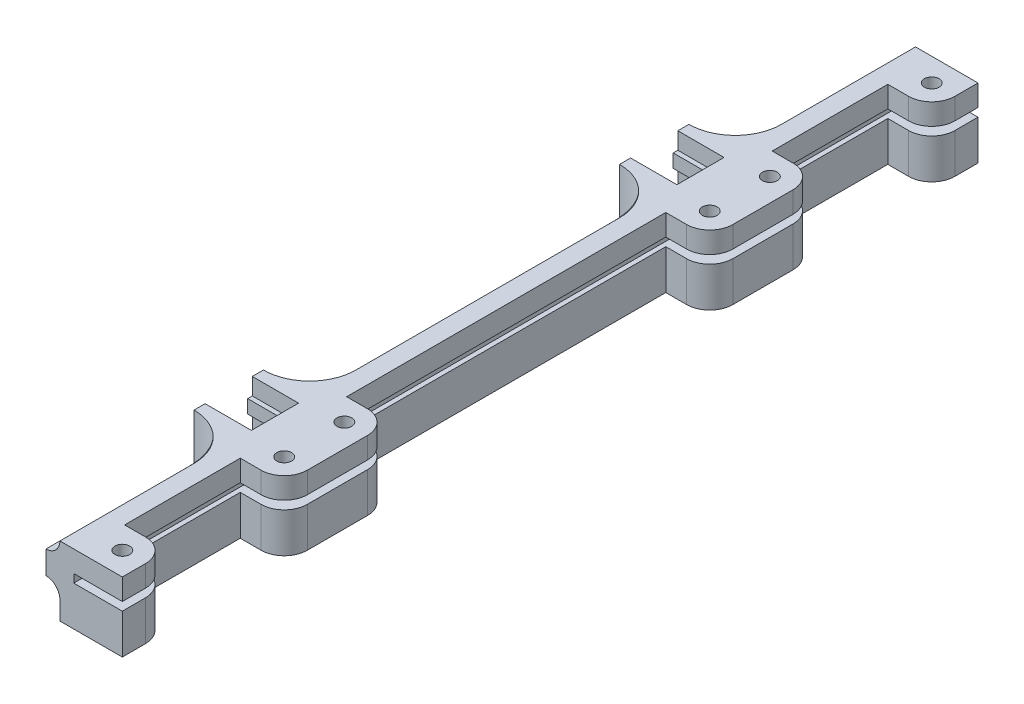
from build123d import *

# Parameters (mm, degrees)
MAIN_DEPTH                       = 185
ESQUISSE3_R                      = 1.6
HOLES_DEPTH                      = 186.90387301
FIXING_DEPTH                     = 10
FIXINGHOLE_DEPTH                 = 186.735026314
CONG_2_R                         = 10
ESQUISSE5_W                      = 9.5
ESQUISSE5_H                      = 25
ESQUISSE5_H_2                    = 69
ENL_V_MAT_EXTRU_3_DEPTH          = 187.061817684
R_P_TITION_LIN_AIRE2_COUNT       = 2
R_P_TITION_LIN_AIRE2_PITCH       = 92
CONG_2_OF_R_P_TITION_LIN_AIRE2_R = 10
CONG_4_R                         = 3
CONG_5_R                         = 5


with BuildPart() as part:
    # Esquisse2 → Main (new body)
    with BuildSketch(Plane.XY):
        Polygon((10.5, 0.9), (0, 0.9), (0, -0.9), (10.5, -0.9), (10.5, -9.5), (-3, -9.5), (-3, -2.5), (-6, -2.5), (-6, 2.5), (-3, 2.5), (-3, 5.5), (10.5, 5.5), align=None)
    extrude(amount=MAIN_DEPTH)

    # Esquisse3 → Holes (cut, through all)
    with BuildSketch(Plane(origin=(0, 5.5, 0), x_dir=(1, 0, 0), z_dir=(0, 1, 0))):
        with Locations(Location((5.5, -5, 0), (0, 0, 180))):
            Circle(ESQUISSE3_R)
        with Locations(Location((5.5, -40, 0), (0, 0, 180))):
            Circle(ESQUISSE3_R)
        with Locations(Location((5.5, -53, 0), (0, 0, 180))):
            Circle(ESQUISSE3_R)
        with Locations(Location((5.5, -145, 0), (0, 0, 180))):
            Circle(ESQUISSE3_R)
        with Locations(Location((5.5, -180, 0), (0, 0, 180))):
            Circle(ESQUISSE3_R)
        with Locations(Location((5.5, -132, 0), (0, 0, 180))):
            Circle(ESQUISSE3_R)
    extrude(amount=-HOLES_DEPTH, mode=Mode.SUBTRACT)

    # Esquisse4 → Fixing (add)
    with BuildSketch(Plane.ZY.offset(3)):
        Polygon((41.4, 5.5), (41.4, 1.85), (42.4, 1.85), (42.4, -1.05), (41.4, -1.05), (41.4, -4.7), (45.05, -4.7), (45.05, -3.7), (47.95, -3.7), (47.95, -4.7), (51.6, -4.7), (51.6, -1.05), (50.6, -1.05), (50.6, 1.85), (51.6, 1.85), (51.6, 5.5), (54, 5.5), (54, -9.5), (39, -9.5), (39, 5.5), align=None)
    fixing = extrude(amount=FIXING_DEPTH)

    # Esquisse6 → FixingHole (cut, through all)
    with BuildSketch(Plane.ZY.offset(3)):
        Polygon((41.4, 2.5), (51.6, 2.5), (51.6, 1.85), (50.6, 1.85), (50.6, -1.05), (51.6, -1.05), (51.6, -2.5), (41.4, -2.5), (41.4, -1.05), (42.4, -1.05), (42.4, 1.85), (41.4, 1.85), align=None)
    fixinghole = extrude(amount=FIXINGHOLE_DEPTH, mode=Mode.SUBTRACT)

    # Congé2
    cong_2_edges = [part.edges().sort_by_distance(p)[0] for p in [
        (-3, 4, 54),
        (-3, 4, 39),
    ]]
    fillet(cong_2_edges, radius=CONG_2_R - 0.0001)  # a hair under: the kernel refuses the full size

    # Esquisse5 → Enlèv. mat.-Extru.3 (cut, through all)
    with BuildSketch(Plane(origin=(0, 5.5, 0), x_dir=(1, 0, 0), z_dir=(0, 1, 0))):
        with Locations((5.75, -22.5)):
            Rectangle(ESQUISSE5_W, ESQUISSE5_H)
        with Locations((5.75, -92.5)):
            Rectangle(ESQUISSE5_W, ESQUISSE5_H_2)
        with Locations((5.75, -162.5)):
            Rectangle(ESQUISSE5_W, ESQUISSE5_H)
    extrude(amount=-ENL_V_MAT_EXTRU_3_DEPTH, mode=Mode.SUBTRACT)

    # Répétition linéaire2: Fixing, FixingHole ×2
    with Locations(*[(0, 0, i * R_P_TITION_LIN_AIRE2_PITCH) for i in range(1, R_P_TITION_LIN_AIRE2_COUNT)]):
        add(fixing)
        add(fixinghole, mode=Mode.SUBTRACT)

    # Congé2 of Répétition linéaire2
    cong_2_of_r_p_tition_lin_aire2_edges = [part.edges().sort_by_distance(p)[0] for p in [
        (-3, 4, 146),
        (-3, 4, 131),
    ]]
    fillet(cong_2_of_r_p_tition_lin_aire2_edges, radius=CONG_2_OF_R_P_TITION_LIN_AIRE2_R - 0.0001)  # a hair under: the kernel refuses the full size

    # Congé4
    cong_4_edges = [part.edges().sort_by_distance(p)[0] for p in [
        (-3, 2.5, 14.50005),
        (-3, -2.5, 170.49995),
        (-3, -2.5, 92.5),
        (-3, -2.5, 14.50005),
        (-3, 2.5, 170.49995),
        (-3, 2.5, 92.5),
        (-3.780455873, 2.5, 152.126936019),
        (-3.780455873, 2.5, 124.873063981),
        (-3.780455873, 2.5, 60.126936019),
        (-3.780455873, -2.5, 152.126936019),
        (-3.780455873, -2.5, 124.873063981),
        (-3.780455873, -2.5, 60.126936019),
        (-3.780455873, -2.5, 32.873063981),
        (-3.780455873, 2.5, 32.873063981),
    ]]
    fillet(cong_4_edges, radius=CONG_4_R - 0.0001)  # a hair under: the kernel refuses the full size

    # Congé5
    cong_5_edges = [part.edges().sort_by_distance(p)[0] for p in [
        (10.5, -5.2, 10),
        (10.5, 3.2, 10),
        (10.5, -5.2, 35),
        (10.5, 3.2, 35),
        (10.5, -5.2, 58),
        (10.5, 3.2, 58),
        (10.5, -5.2, 127),
        (10.5, 3.2, 127),
        (10.5, -5.2, 150),
        (10.5, 3.2, 150),
        (10.5, -5.2, 175),
        (10.5, 3.2, 175),
    ]]
    fillet(cong_5_edges, radius=CONG_5_R)


solid = part.part
